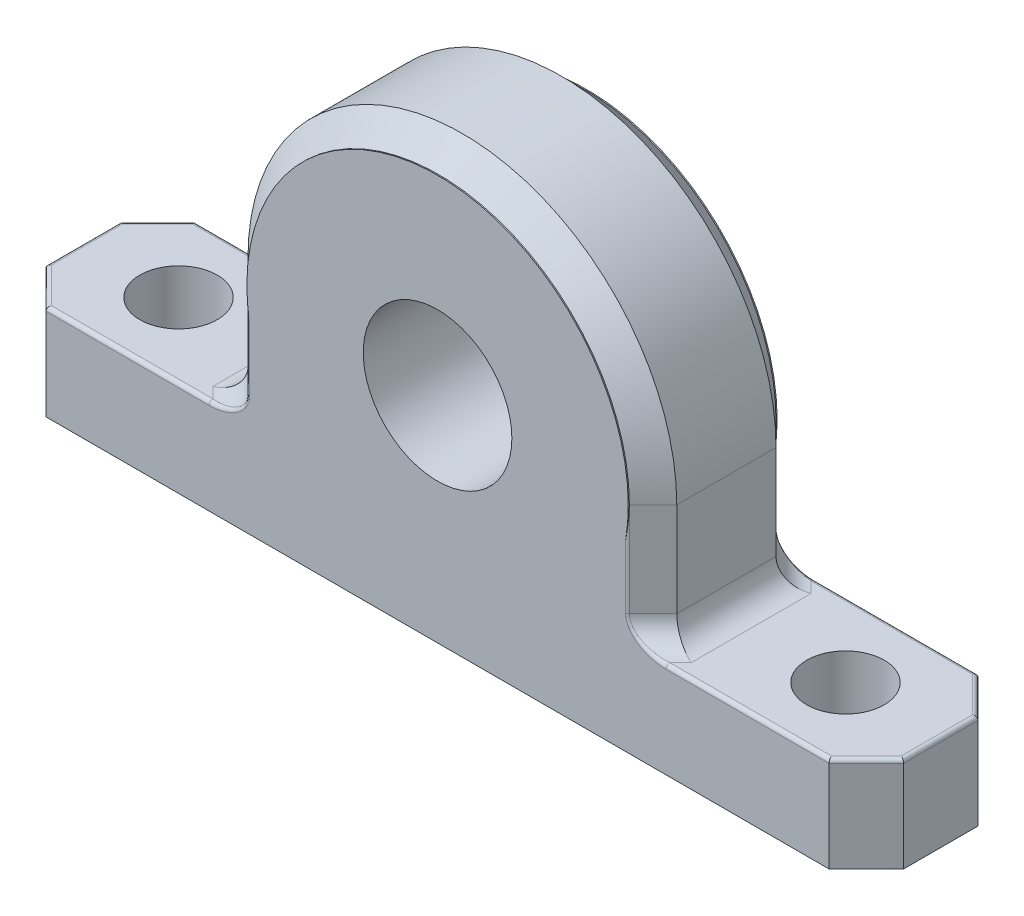
from build123d import *
from OCP.BRepAlgoAPI import BRepAlgoAPI_Cut
from OCP.TopTools import TopTools_ListOfShape

# Parameters (mm, degrees)
EXTRUDE1_DEPTH      = 4.960938
EXTRUDE1_DEPTH_BACK = 4.960938
SKETCH3_R           = 10.715625
SKETCH4_R           = 2.5796875
CUT_EXTRUDE1_DEPTH  = 37.538912899
CHAMFER3_SIZE       = 1.653645833
FILLET6_R           = 1.653645833
FILLET7_R           = 0.254
CHAMFER4_SIZE       = 0.381
CHAMFER5_SIZE       = 0.127
FILLET8_R           = 0.635
BOSS_EXTRUDE1_REACH = 35.453
SKETCH6_R           = 12.708249044
CUT_EXTRUDE2_REACH  = 35.453
SKETCH7_R           = 4.953


with BuildPart() as part:
    # Sketch3 → Extrude1 (new, two sides: drawn at the far end of the back side and taken through both)
    with BuildSketch(Plane.XY.offset(-EXTRUDE1_DEPTH_BACK)):
        with BuildLine():
            Line((14.2875, 0), (14.2875, -7.9375))
            Line((14.2875, -7.9375), (28.575, -7.9375))
            Line((28.575, -7.9375), (28.575, -14.2875))
            Line((28.575, -14.2875), (-28.575, -14.2875))
            Line((-28.575, -14.2875), (-28.575, -7.9375))
            Line((-28.575, -7.9375), (-14.2875, -7.9375))
            Line((-14.2875, -7.9375), (-14.2875, 0))
            ThreePointArc((-14.2875, 0), (0, 14.2875), (14.2875, 0))
        make_face()
        with Locations(Location((0, 0, 0), (0, 0, 180))):
            Circle(SKETCH3_R, mode=Mode.SUBTRACT)
    extrude(amount=EXTRUDE1_DEPTH + EXTRUDE1_DEPTH_BACK)


with BuildPart() as cut_extrude1_tool:
    # Sketch4 → Cut-Extrude1 (new, through all)
    with BuildSketch(Plane(origin=(0, -7.9375, 0), x_dir=(1, 0, 0), z_dir=(0, 1, 0))):
        with Locations(Location((-22.225, 0, 0), (0, 0, 270))):
            Circle(SKETCH4_R)
        with Locations(Location((22.225, 0, 0), (0, 0, 270))):
            Circle(SKETCH4_R)
        Polygon((-28.575, 4.9609375), (-28.575, 2.48046875), (-26.09453125, 4.9609375), align=None)
        Polygon((26.09453125, 4.9609375), (28.575, 4.9609375), (28.575, 2.48046875), align=None)
        Polygon((28.575, -4.9609375), (28.575, -2.48046875), (26.09453125, -4.9609375), align=None)
        Polygon((-26.09453125, -4.9609375), (-28.575, -4.9609375), (-28.575, -2.48046875), align=None)
    extrude(amount=-CUT_EXTRUDE1_DEPTH)


with BuildPart() as part_1:
    add(part.part)

    # Cut-Extrude1: cut by cut_extrude1_tool, with a tolerance
    cut_extrude1_stock = TopTools_ListOfShape()
    cut_extrude1_stock.Append(part_1.part.wrapped)
    cut_extrude1_tools = TopTools_ListOfShape()
    cut_extrude1_tools.Append(cut_extrude1_tool.part.wrapped)
    cut_extrude1_cut = BRepAlgoAPI_Cut()
    cut_extrude1_cut.SetArguments(cut_extrude1_stock)
    cut_extrude1_cut.SetTools(cut_extrude1_tools)
    cut_extrude1_cut.SetFuzzyValue(0.00001)
    cut_extrude1_cut.Build()
    add(Compound.cast(cut_extrude1_cut.Shape()).solids(), mode=Mode.REPLACE)

    # Chamfer3
    chamfer3_edges = [part_1.edges().sort_by_distance(p)[0] for p in [
        (0, 14.2875, -4.960938),
        (14.2875, -3.96875, -4.960938),
        (14.2875, -3.96875, 4.960938),
        (-14.2875, -3.96875, -4.960938),
        (0, 14.2875, 4.960938),
        (-14.2875, -3.96875, 4.960938),
    ]]
    chamfer(chamfer3_edges, length=CHAMFER3_SIZE)

    # Fillet6
    fillet6_edges = [part_1.edges().sort_by_distance(p)[0] for p in [
        (14.2875, -7.9375, 0),
        (-13.460677083, -7.9375, -4.134115083),
        (13.460677083, -7.9375, -4.134115083),
        (-13.460677083, -7.9375, 4.134115083),
        (13.460677083, -7.9375, 4.134115083),
        (-14.2875, -7.9375, 0),
    ]]
    fillet(fillet6_edges, radius=FILLET6_R)

    # Fillet7
    fillet7_edges = [part_1.edges().sort_by_distance(p)[0] for p in [
        (12.633854167, -3.141927083, -4.960938),
        (0, 12.633854167, -4.960938),
        (0, 12.633854167, 4.960938),
        (-12.633854167, -3.141927083, 4.960938),
        (-20.533496891, -7.9375, 4.960937707),
        (-20.533496891, -7.9375, -4.960937707),
        (-12.633854167, -3.141927083, -4.960938),
        (12.633854167, -3.141927083, 4.960938),
        (-13.461607153, -7.546075444, -4.960938),
        (-13.461607153, -7.546075444, 4.960938),
        (13.461607153, -7.546075444, -4.960938),
        (13.461607153, -7.546075444, 4.960938),
        (-27.334765625, -7.9375, -3.720703125),
        (20.533496891, -7.9375, -4.960937707),
        (27.334765625, -7.9375, -3.720703125),
        (28.575, -7.9375, 0),
        (20.533496891, -7.9375, 4.960937707),
        (27.334765625, -7.9375, 3.720703125),
        (-28.575, -7.9375, 0),
        (-27.334765625, -7.9375, 3.720703125),
    ]]
    fillet(fillet7_edges, radius=FILLET7_R)

    # Chamfer4
    chamfer4_edges = [part_1.edges().sort_by_distance(p)[0] for p in [
        (10.715625, 0, 4.960938),
        (10.715625, 0, -4.960938),
    ]]
    chamfer(chamfer4_edges, length=CHAMFER4_SIZE)

    # Boss-Extrude1: up to this face of the body (flat: up to its plane)
    boss_extrude1_end = Plane(part_1.part.faces().sort_by_distance((11.68337911, 0, -4.960938))[0])
    # Sketch6 → Boss-Extrude1 (add, up to the picked face)
    with BuildSketch(Plane.XY.offset(4.9609375), mode=Mode.PRIVATE) as boss_extrude1_sk1:
        Circle(SKETCH6_R)
    boss_extrude1_tool1 = split(extrude(boss_extrude1_sk1.sketch, amount=-BOSS_EXTRUDE1_REACH, mode=Mode.PRIVATE), bisect_by=boss_extrude1_end, keep=Keep.BOTH, mode=Mode.PRIVATE)


with BuildPart() as body_2:
    # Sketch5 → Revolve1 (revolve)
    with BuildSketch(Plane(origin=(0, 0, 0), x_dir=(0, 0, -1), z_dir=(1, 0, 0)), mode=Mode.PRIVATE) as revolve1_sk:
        Polygon((-4.4529375, 9.7234375), (-3.4369375, 9.7234375), (-3.4369375, 8.5328125), (-4.8339375, 8.5328125), (-4.8339375, 7.7390625), (-4.3259375, 7.7390625), (-4.3259375, 7.6120625), (-4.9609375, 7.6120625), (-4.9609375, 4.7625), (4.9609375, 4.7625), (4.9609375, 7.6120625), (4.3259375, 7.6120625), (4.3259375, 7.7390625), (4.8339375, 7.7390625), (4.8339375, 8.5328125), (3.4369375, 8.5328125), (3.4369375, 9.7234375), (4.4529375, 9.7234375), (4.4529375, 10.715625), (-4.4529375, 10.715625), align=None)
    revolve(revolve1_sk.sketch.rotate(Axis((0, 0, -4.9609375), (0, 0, 1)), 90), axis=Axis((0, 0, -4.9609375), (0, 0, 1)))

    # Chamfer5
    chamfer5_edges = [body_2.edges().sort_by_distance(p)[0] for p in [
        (8.5328125, 0, 4.8339375),
        (7.7390625, 0, 4.8339375),
        (7.6120625, 0, 4.9609375),
        (4.7625, 0, 4.9609375),
        (4.7625, 0, -4.9609375),
        (7.6120625, 0, -4.9609375),
        (7.7390625, 0, -4.8339375),
        (8.5328125, 0, -4.8339375),
        (9.7234375, 0, -4.4529375),
        (10.715625, 0, -4.4529375),
        (10.715625, 0, 4.4529375),
        (9.7234375, 0, 4.4529375),
    ]]
    chamfer(chamfer5_edges, length=CHAMFER5_SIZE)

    # Fillet8
    fillet8_edges = [body_2.edges().sort_by_distance(p)[0] for p in [
        (8.5328125, 0, 3.4369375),
        (8.5328125, 0, -3.4369375),
    ]]
    fillet(fillet8_edges, radius=FILLET8_R)


with BuildPart() as part_2:
    add(part_1.part)

    add(body_2.part)  # Boss-Extrude1 merges body 2
    add(boss_extrude1_tool1.solids().sort_by(Axis((0, 0, 4.960938), (0, 0, -1)))[0])

    # Sketch7 → Cut-Extrude2 (cut, up to next)
    with BuildSketch(Plane.XY.offset(4.9609375), mode=Mode.PRIVATE) as cut_extrude2_sk1:
        Circle(SKETCH7_R)
    cut_extrude2_tool1 = extrude(cut_extrude2_sk1.sketch, amount=-CUT_EXTRUDE2_REACH, mode=Mode.PRIVATE) & part_2.part
    add(cut_extrude2_tool1.solids().sort_by_distance((0, 0, 4.960938))[0], mode=Mode.SUBTRACT)


solid = part_2.part
